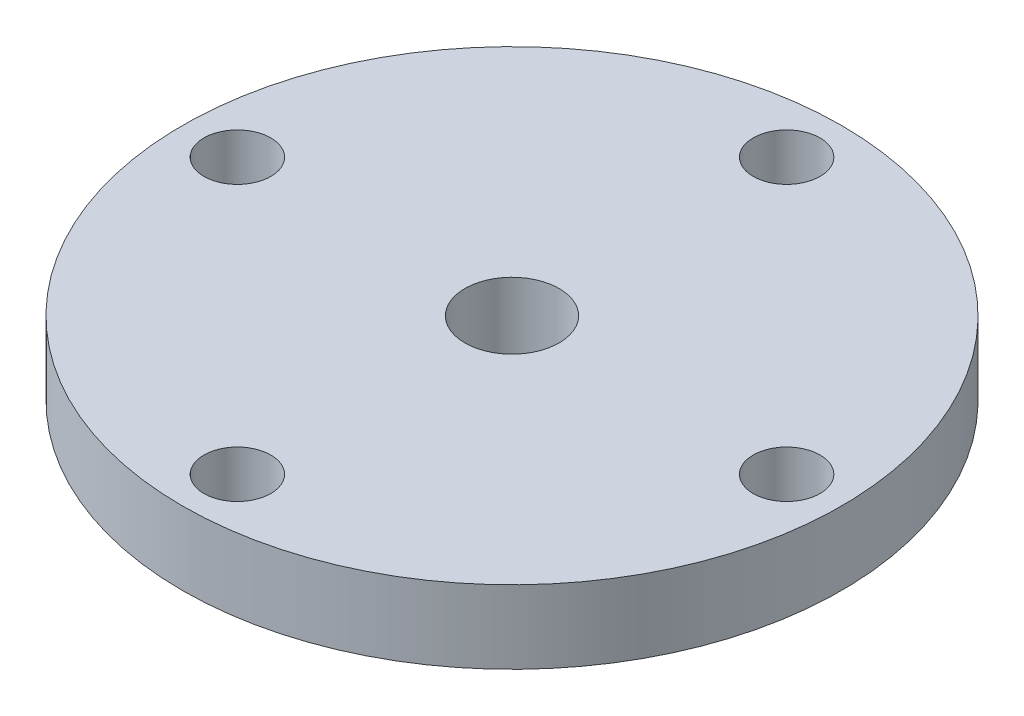
from build123d import *

# Parameters (mm, degrees)
SKETCH1_R           = 18
BOSS_EXTRUDE1_DEPTH = 4
SKETCH2_R           = 1.825
SKETCH2_R_2         = 2.575
CUT_EXTRUDE1_DEPTH  = 26.768197453


with BuildPart() as part:
    # Sketch1 → Boss-Extrude1 (new body)
    with BuildSketch(Plane(origin=(0, 0, 0), x_dir=(1, 0, 0), z_dir=(0, 1, 0))):
        Circle(SKETCH1_R)
    extrude(amount=BOSS_EXTRUDE1_DEPTH)

    # Sketch2 → Cut-Extrude1 (cut, through all)
    with BuildSketch(Plane(origin=(0, 4, 0), x_dir=(1, 0, 0), z_dir=(0, 1, 0))):
        with Locations((0, 15)):
            Circle(SKETCH2_R)
        with Locations((15, 0)):
            Circle(SKETCH2_R)
        with Locations((0, -15)):
            Circle(SKETCH2_R)
        Circle(SKETCH2_R_2)
        with Locations((-15, 0)):
            Circle(SKETCH2_R)
    extrude(amount=-CUT_EXTRUDE1_DEPTH, mode=Mode.SUBTRACT)


solid = part.part
